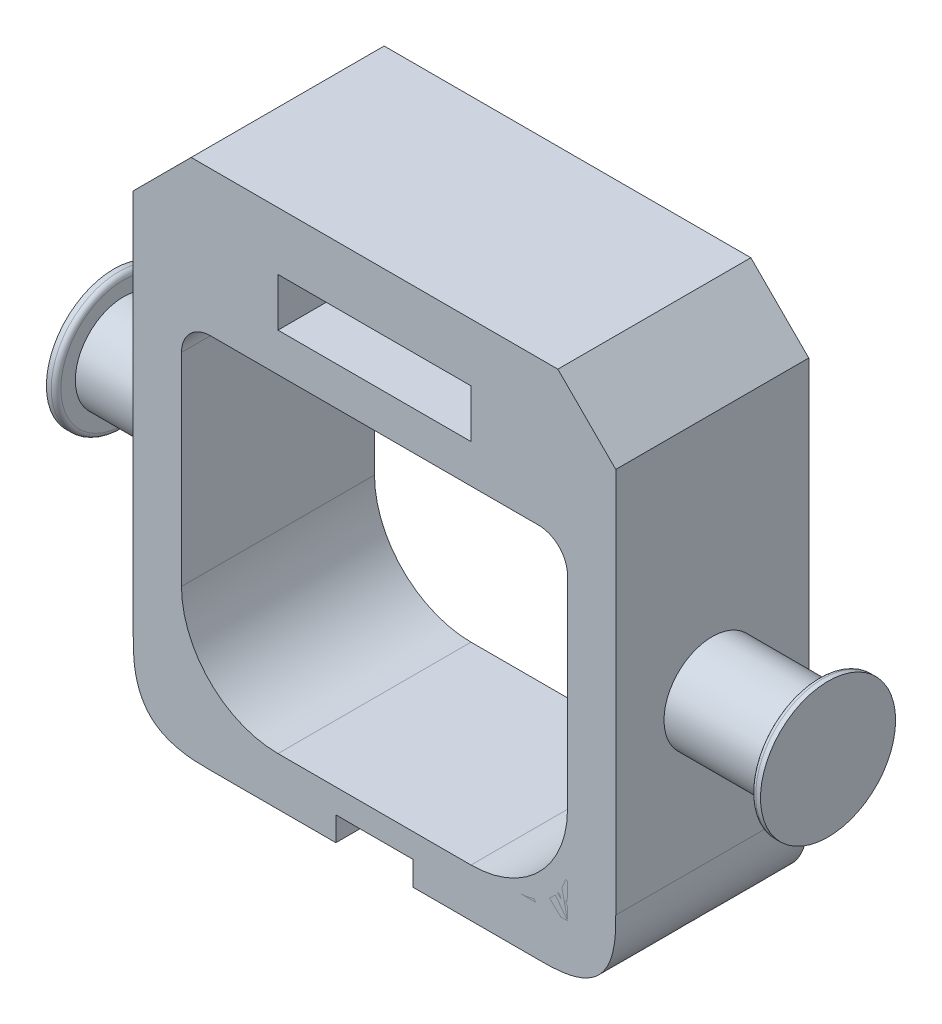
from build123d import *

# Parameters (mm, degrees)
SKETCH1_W            = 25
SKETCH1_H            = 27
SKETCH1_W_2          = 20
SKETCH1_H_2          = 17
BOSS_EXTRUDE1_DEPTH  = 10
FILLET1_SIZE         = 4
BOSS_EXTRUDE2_DEPTH  = 10
BOSS_EXTRUDE3_DEPTH  = 10
BOSS_EXTRUDE4_DEPTH  = 7.5
BOSS_EXTRUDE5_DEPTH  = 10
CHAMFER1_SIZE        = 3
SKETCH8_W            = 10
SKETCH8_H            = 2.5
CUT_EXTRUDE1_DEPTH   = 10.5
SKETCH19_W           = 4
SKETCH19_H           = 1.25
CUT_EXTRUDE5_DEPTH   = 32.408597715
SKETCH20_R           = 2.5
BOSS_EXTRUDE10_DEPTH = 6
SKETCH21_R           = 3.5
BOSS_EXTRUDE11_DEPTH = 0.5
FILLET2_R            = 0.25
FILLET3_R            = 0.25


with BuildPart() as part:
    # Sketch1 → Boss-Extrude1 (new body)
    with BuildSketch(Plane.XY):
        with Locations((-10, -6)):
            Rectangle(SKETCH1_W, SKETCH1_H)
        with Locations((-10, -8.5)):
            Rectangle(SKETCH1_W_2, SKETCH1_H_2, mode=Mode.SUBTRACT)
    extrude(amount=BOSS_EXTRUDE1_DEPTH)

    # Fillet1
    # a fillet whose section is not a circle: 4 mm, written as the material it takes off along each edge
    with BuildSketch(Plane(origin=(-22.5, -19.5, -10), x_dir=(0, 1, 0), z_dir=(0, 0, 1)), Plane(origin=(2.5, -19.5, -10), x_dir=(-1, 0, 0), z_dir=(0, 0, 1))) as fillet1_piece_1:
        with BuildLine():
            add(Edge.make_bspline([(FILLET1_SIZE, 0), (FILLET1_SIZE * 0.831801948466, 0), (FILLET1_SIZE * 0.663603896932, 0), (FILLET1_SIZE * 0.292893218813, -FILLET1_SIZE * 0.0716919198361), (FILLET1_SIZE * 0.0716919198361, -FILLET1_SIZE * 0.292893218813), (0, -FILLET1_SIZE * 0.663603896932), (0, -FILLET1_SIZE * 0.831801948466), (0, -FILLET1_SIZE)], knots=[0, 0, 0, 0, 0, 0, 0.5, 0.5, 1, 1, 1, 1, 1, 1], degree=5))
            Line((0, -FILLET1_SIZE), (0, 0))
            Line((0, 0), (FILLET1_SIZE, 0))
        make_face()
    extrude(amount=30, mode=Mode.SUBTRACT)

    # Sketch3 → Boss-Extrude2 (add)
    with BuildSketch(Plane.XY.offset(10)):
        with BuildLine():
            Line((-18.5, 0), (-20, 0))
            Line((-20, 0), (-20, -1.5))
            ThreePointArc((-20, -1.5), (-19.560660172, -0.439339828), (-18.5, 0))
        make_face()
    extrude(amount=-BOSS_EXTRUDE2_DEPTH)

    # Sketch4 → Boss-Extrude3 (add)
    with BuildSketch(Plane.XY.offset(10)):
        with BuildLine():
            Line((0, 0), (0, -1.495394009))
            ThreePointArc((0, -1.495394009), (-0.437990765, -0.437990765), (-1.495394009, 0))
            Line((-1.495394009, 0), (0, 0))
        make_face()
    extrude(amount=-BOSS_EXTRUDE3_DEPTH)

    # Sketch7 → Boss-Extrude5 (add)
    with BuildSketch(Plane.XY.offset(10)):
        with BuildLine():
            Line((-20, -17), (-15, -17))
            ThreePointArc((-15, -17), (-18.535533906, -15.535533906), (-20, -12))
            Line((-20, -12), (-20, -17))
        make_face()
        with BuildLine():
            Line((0, -17), (-5, -17))
            ThreePointArc((-5, -17), (-1.464466094, -15.535533906), (0, -12))
            Line((0, -12), (0, -17))
        make_face()
    extrude(amount=-BOSS_EXTRUDE5_DEPTH)

    # Chamfer1
    chamfer1_edges = [part.edges().sort_by_distance(p)[0] for p in [
        (2.5, 7.5, 5),
        (-22.5, 7.5, 5),
    ]]
    chamfer(chamfer1_edges, length=CHAMFER1_SIZE)

    # Sketch8 → Cut-Extrude1 (cut)
    with BuildSketch(Plane.XY.offset(10)):
        with Locations((-10, 3.25)):
            Rectangle(SKETCH8_W, SKETCH8_H)
    extrude(amount=-CUT_EXTRUDE1_DEPTH, mode=Mode.SUBTRACT)

    # Sketch19 → Cut-Extrude5 (cut, through all)
    with BuildSketch(Plane.XY.offset(10)):
        with Locations((-10, -18.875)):
            Rectangle(SKETCH19_W, SKETCH19_H)
    extrude(amount=-CUT_EXTRUDE5_DEPTH, mode=Mode.SUBTRACT)

    # Sketch20 → Boss-Extrude10 (add)
    with BuildSketch(Plane(origin=(2.5, 0, 0), x_dir=(0, 0, -1), z_dir=(1, 0, 0))):
        with Locations(Location((-5, -8, 0), (0, 0, 180))):
            Circle(SKETCH20_R)
    boss_extrude10 = extrude(amount=BOSS_EXTRUDE10_DEPTH)

    # Sketch21 → Boss-Extrude11 (add)
    with BuildSketch(Plane(origin=(8.5, 0, 0), x_dir=(0, 0, -1), z_dir=(1, 0, 0))):
        with Locations((-5, -8)):
            Circle(SKETCH21_R)
    boss_extrude11 = extrude(amount=-BOSS_EXTRUDE11_DEPTH)

    # Fillet2
    fillet2_edges = [part.edges().sort_by_distance(p)[0] for p in [
        (8, -8, 8.5),
    ]]
    fillet(fillet2_edges, radius=FILLET2_R)

    # Mirror1: Boss-Extrude10, Boss-Extrude11 across plane
    add(boss_extrude10.mirror(Plane.ZY.offset(10)))
    add(boss_extrude11.mirror(Plane.ZY.offset(10)))

    # Fillet3
    fillet3_edges = [part.edges().sort_by_distance(p)[0] for p in [
        (-28, -8, 8.5),
    ]]
    fillet(fillet3_edges, radius=FILLET3_R)


with BuildPart() as body_2:
    # Sketch6 → Boss-Extrude4 (new body)
    with BuildSketch(Plane.XY.offset(10)):
        with BuildLine():
            Line((0, -17), (0, -14.5))
            ThreePointArc((0, -14.5), (-0.732233047, -16.267766953), (-2.5, -17))
            Line((-2.5, -17), (0, -17))
        make_face()
    extrude(amount=-BOSS_EXTRUDE4_DEPTH)


solid = Compound([part.part, body_2.part])
